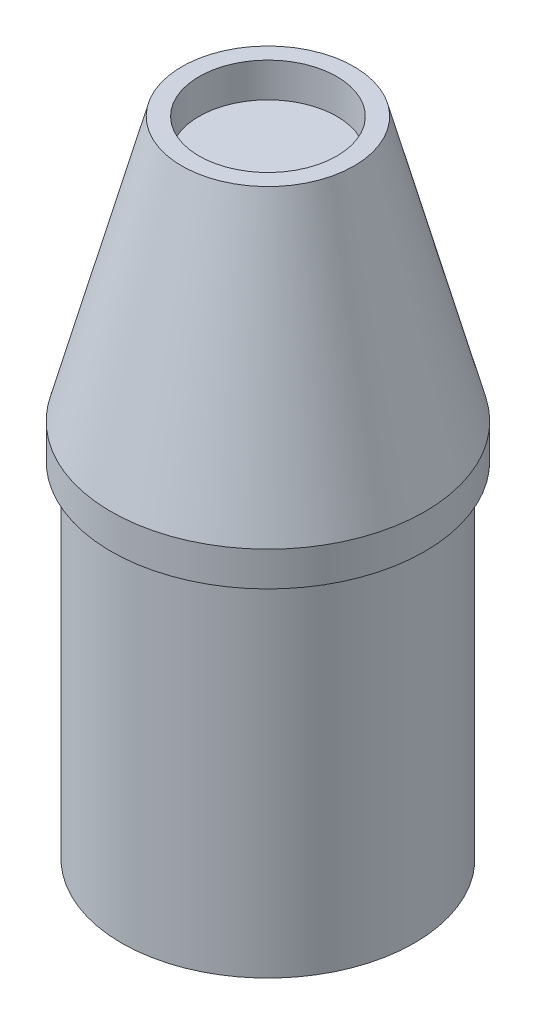
from build123d import *


with BuildPart() as part:
    # Sketch1 → Revolve1 (revolve)
    with BuildSketch(Plane.XY):
        Polygon((0, -13.774725563), (0, 98.402039915), (12.7, 98.402039915), (12.7, 104.752039915), (15.875, 104.752039915), (28.9179, 56.075274437), (28.9179, 49.725274437), (26.9875, 49.725274437), (26.9875, -13.774725563), align=None)
    revolve(axis=Axis((0, -13.774725563, 0), (0, 1, 0)))


solid = part.part
